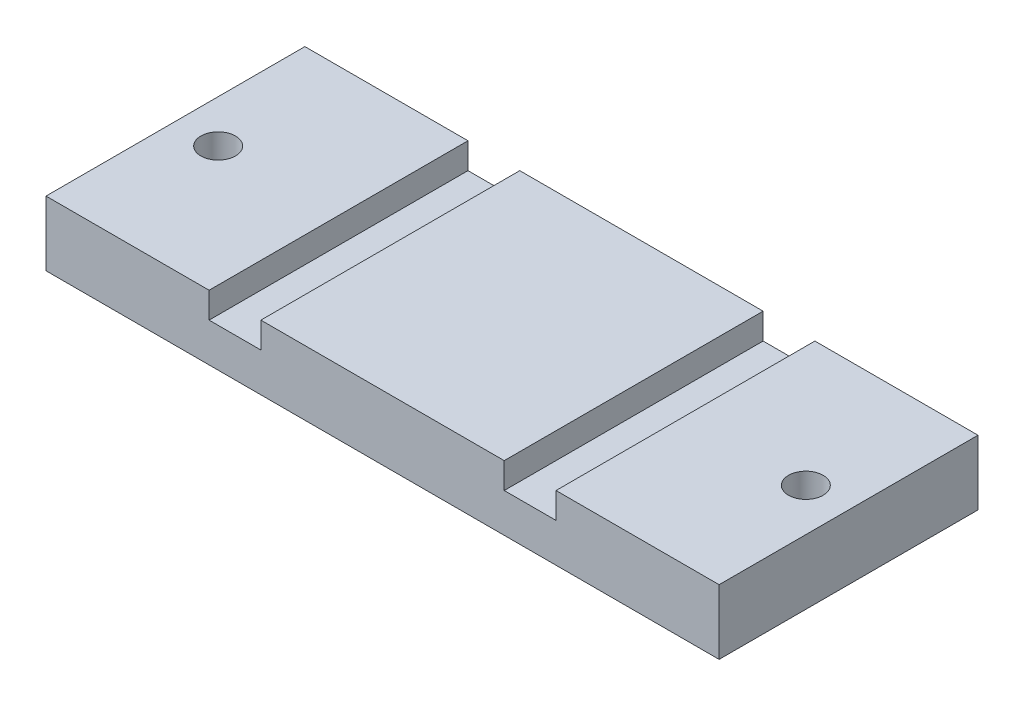
from build123d import *

# Parameters (mm, degrees)
SKETCH1_W            = 66.04
SKETCH1_H            = 25.4
BOSS_EXTRUDE1_DEPTH  = 6.35
M3_CLEARANCE_HOLE1_D = 3.4
SKETCH5_W            = 5.08
SKETCH5_H            = 2.54
CUT_EXTRUDE1_DEPTH   = 72.040580656


with BuildPart() as part:
    # Sketch1 → Boss-Extrude1 (new body)
    with BuildSketch(Plane(origin=(0, 0, 0), x_dir=(1, 0, 0), z_dir=(0, 1, 0))):
        with Locations((33.02, 12.7)):
            Rectangle(SKETCH1_W, SKETCH1_H)
    extrude(amount=BOSS_EXTRUDE1_DEPTH)

    # M3 Clearance Hole1 (through all)
    with Locations(Plane(origin=(0, 6.35, 0), x_dir=(1, 0, 0), z_dir=(0, 1, 0))):
        with Locations((4.191, 12.7), (61.849, 12.7)):
            Hole(M3_CLEARANCE_HOLE1_D / 2)

    # Sketch5 → Cut-Extrude1 (cut, through all)
    with BuildSketch(Plane.XY):
        with Locations((47.498, 5.08)):
            Rectangle(SKETCH5_W, SKETCH5_H)
        with Locations((18.542, 5.08)):
            Rectangle(SKETCH5_W, SKETCH5_H)
    extrude(amount=-CUT_EXTRUDE1_DEPTH, mode=Mode.SUBTRACT)


solid = part.part
